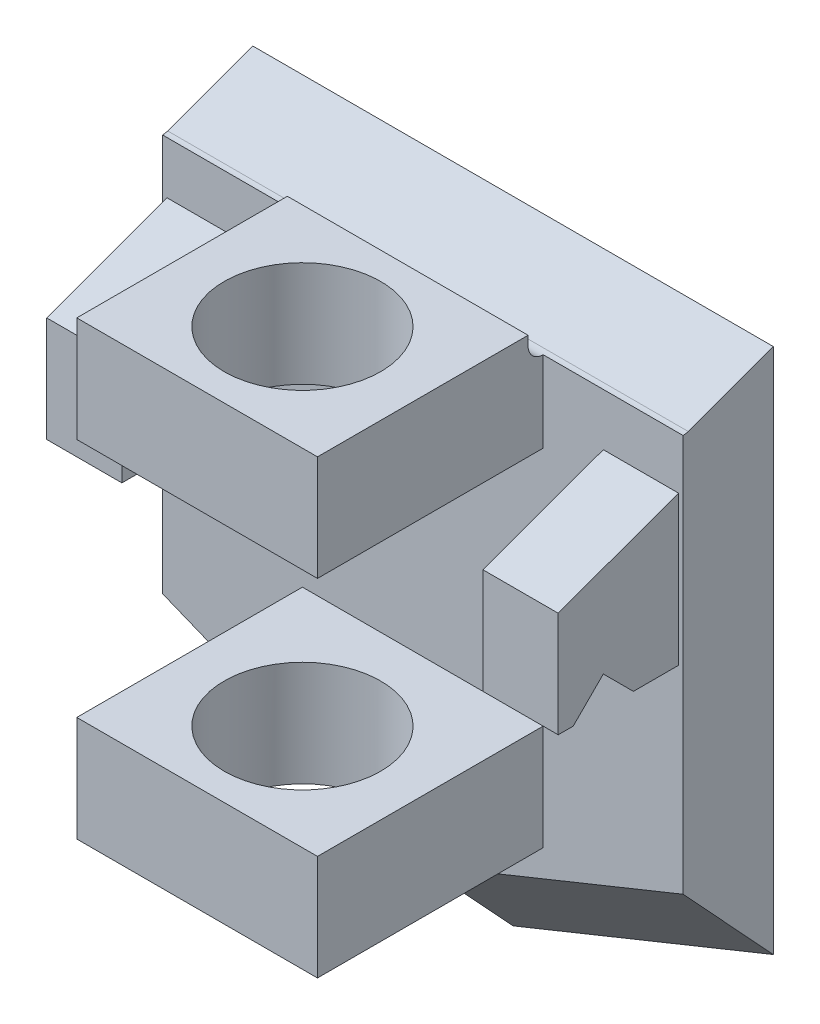
from build123d import *

# Parameters (mm, degrees)
ESBO_O1_W                     = 34.6
ESBO_O1_H                     = 26
RESSALTO_EXTRUS_O1_DEPTH      = 7
ESBO_O10_W                    = 34.6
ESBO_O10_H                    = 2.5
RESSALTO_EXTRUS_O4_DEPTH      = 7
CHANFRO1_SIZE                 = 7
CHANFRO2_SIZE2                = 7
CHANFRO2_SIZE                 = 2.54779164
RESSALTO_EXTRUS_O5_DEPTH      = 15
RESSALTO_EXTRUS_O5_DEPTH_BACK = 15
ESBO_O11_W                    = 16
ESBO_O11_H                    = 14
ESBO_O11_R                    = 5.2
CORTE_EXTRUS_O2_DEPTH         = 1
FILETE1_R                     = 1
RESSALTO_EXTRUS_O6_START      = 12
RESSALTO_EXTRUS_O6_DEPTH      = 5
ESBO_O15_W                    = 19.413269766
ESBO_O15_H                    = 16
CORTE_EXTRUS_O3_DEPTH         = 15


with BuildPart() as part:
    # Esboço1 → Ressalto-extrusão1 (new body)
    with BuildSketch(Plane.XY):
        Rectangle(ESBO_O1_W, ESBO_O1_H)
    extrude(amount=RESSALTO_EXTRUS_O1_DEPTH)

    # Esboço10 → Ressalto-extrusão4 (add)
    with BuildSketch(Plane(origin=(0, 0, 0), x_dir=(-1, 0, 0), z_dir=(0, 0, -1))):
        Polygon((-17.3, -19.5), (0, -26.5), (17.3, -19.5), (17.3, -13), (-17.3, -13), align=None)
        with Locations((0, 14.25)):
            Rectangle(ESBO_O10_W, ESBO_O10_H)
    extrude(amount=-RESSALTO_EXTRUS_O4_DEPTH)

    # Chanfro1
    chanfro1_edges = [part.edges().sort_by_distance(p)[0] for p in [
        (8.65, -23, 7),
        (-8.65, -23, 7),
    ]]
    chamfer(chanfro1_edges, length=CHANFRO1_SIZE - 0.0001)  # a hair under: the kernel refuses the full size

    # Chanfro2
    chanfro2_edges = [part.edges().sort_by_distance(p)[0] for p in [
        (0, 15.5, 7),
    ]]
    chanfro2_side = [part.faces().sort_by_distance(p)[0] for p in [
        (0, 15.449044167, 7),
    ]]
    chamfer(chanfro2_edges, length=CHANFRO2_SIZE - 0.0001, length2=CHANFRO2_SIZE2 - 0.0001, reference=chanfro2_side[0])  # a hair under: the kernel refuses the full size

    # Esboço11 → Ressalto-extrusão5 (add, two sides: drawn at the far end of the back side and taken through both)
    with BuildSketch(Plane(origin=(0, 0, 0), x_dir=(1, 0, 0), z_dir=(0, 1, 0)).offset(-RESSALTO_EXTRUS_O5_DEPTH_BACK)):
        with Locations((0, -14)):
            Rectangle(ESBO_O11_W, ESBO_O11_H)
        with Locations(Location((0, -14, 0), (0, 0, 270))):
            Circle(ESBO_O11_R, mode=Mode.SUBTRACT)
    extrude(amount=RESSALTO_EXTRUS_O5_DEPTH + RESSALTO_EXTRUS_O5_DEPTH_BACK)

    # Esboço13 → Corte-extrusão2 (cut)
    with BuildSketch(Plane.XY.offset(7)):
        Polygon((8, -15), (-8, -15), (-8, 18.845540147), (-17.3, 18.845540147), (-17.3, -24.216996946), (-0.570267535, -24.216996946), (17.3, -21.247378204), (17.3, 18.845540147), (8, 18.845540147), align=None)
    extrude(amount=-CORTE_EXTRUS_O2_DEPTH, mode=Mode.SUBTRACT)

    # Filete1
    filete1_edges = [part.edges().sort_by_distance(p)[0] for p in [
        (0, 12.95230836, 7),
    ]]
    fillet(filete1_edges, radius=FILETE1_R)

    # Esboço14 → Ressalto-extrusão6 (add)
    with BuildSketch(Plane(origin=(0, 0, 0), x_dir=(0, 0, -1), z_dir=(1, 0, 0)).offset(RESSALTO_EXTRUS_O6_START)):
        Polygon((-6, 9.911761874), (-14, 7), (-14, 0), (-13, 0), (-11, 2), (-9, 0), (-6, 0), align=None)
    ressalto_extrus_o6 = extrude(amount=RESSALTO_EXTRUS_O6_DEPTH)

    # Espelhar1: Ressalto-extrusão6 across plane
    add(ressalto_extrus_o6.mirror(Plane(origin=(0, 0, 0), x_dir=(0, 0, 1), z_dir=(1, 0, 0))))

    # Esboço15 → Corte-extrusão3 (cut)
    with BuildSketch(Plane.XY.offset(21)):
        Rectangle(ESBO_O15_W, ESBO_O15_H)
    extrude(amount=-CORTE_EXTRUS_O3_DEPTH, mode=Mode.SUBTRACT)


solid = part.part
